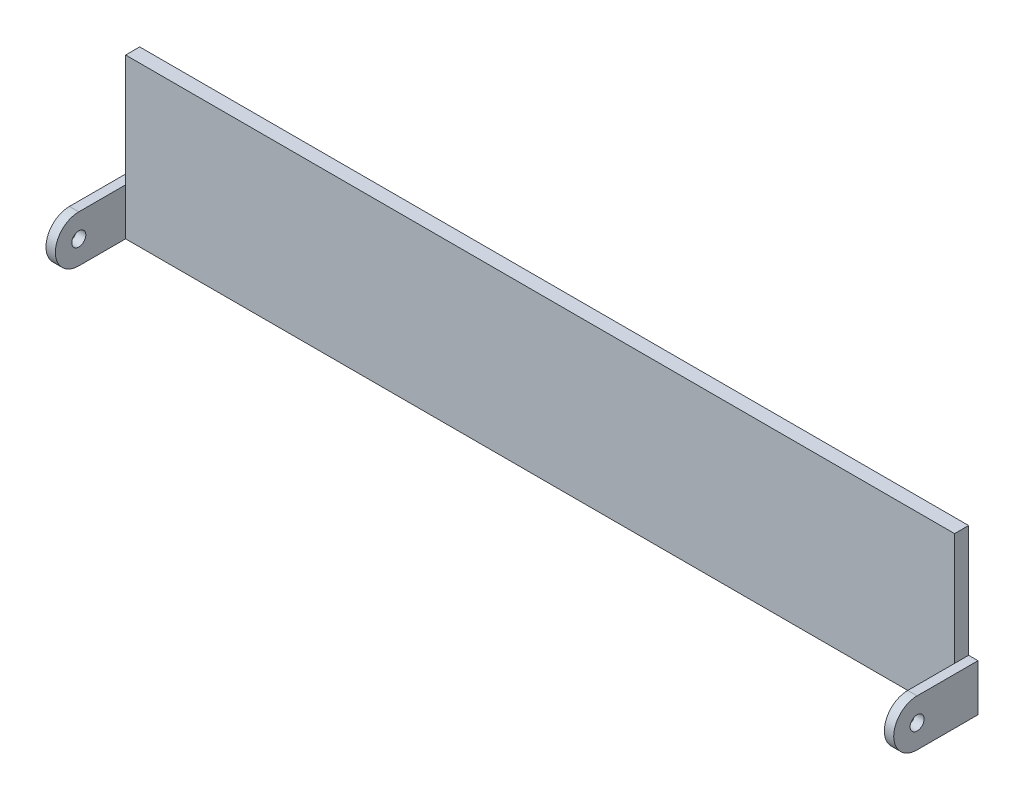
from build123d import *

# Parameters (mm, degrees)
SKETCH1_W           = 177
SKETCH1_H           = 34
BOSS_EXTRUDE1_DEPTH = 3
SKETCH2_R           = 5
SKETCH2_W           = 13
SKETCH2_H           = 10
BOSS_EXTRUDE2_DEPTH = 2
BOSS_EXTRUDE3_START = 2
SKETCH3_R           = 5
SKETCH3_W           = 13
SKETCH3_H           = 10
BOSS_EXTRUDE3_DEPTH = 2
SKETCH4_R           = 1.5
CUT_EXTRUDE1_DEPTH  = 200


with BuildPart() as part:
    # Sketch1 → Boss-Extrude1 (new body)
    with BuildSketch(Plane.XY):
        with Locations((2, -4.5)):
            Rectangle(SKETCH1_W, SKETCH1_H)
    extrude(amount=BOSS_EXTRUDE1_DEPTH)

    # Sketch2 → Boss-Extrude2 (add)
    with BuildSketch(Plane.ZY.offset(86.5)):
        with Locations((13, -16.5)):
            Circle(SKETCH2_R)
        with Locations((6.5, -16.5)):
            Rectangle(SKETCH2_W, SKETCH2_H)
    extrude(amount=BOSS_EXTRUDE2_DEPTH)

    # Sketch3 → Boss-Extrude3 (add)
    with BuildSketch(Plane(origin=(90.5, 0, 0), x_dir=(0, 0, -1), z_dir=(1, 0, 0)).offset(BOSS_EXTRUDE3_START)):
        with Locations((-13, -16.5)):
            Circle(SKETCH3_R)
        with Locations((-6.5, -16.5)):
            Rectangle(SKETCH3_W, SKETCH3_H)
    extrude(amount=-BOSS_EXTRUDE3_DEPTH)

    # Sketch4 → Cut-Extrude1 (cut)
    with BuildSketch(Plane(origin=(92.5, 0, 0), x_dir=(0, 0, -1), z_dir=(1, 0, 0))):
        with Locations((-13, -16.5)):
            Circle(SKETCH4_R)
    extrude(amount=-CUT_EXTRUDE1_DEPTH, mode=Mode.SUBTRACT)


solid = part.part
